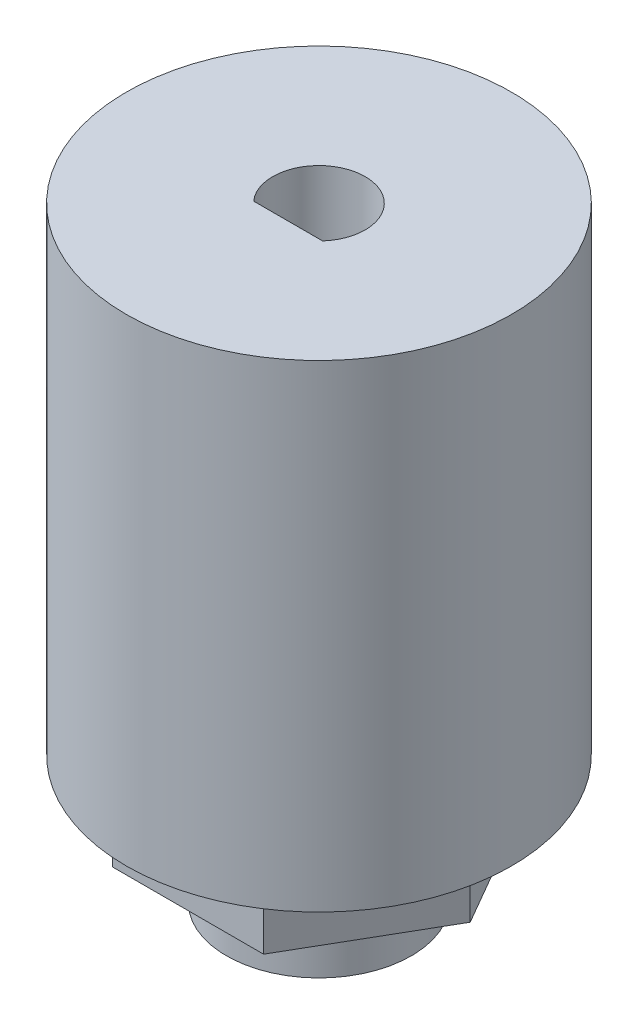
from build123d import *

# Parameters (mm, degrees)
SKETCH1_R           = 6
BOSS_EXTRUDE1_DEPTH = 3.8
BOSS_EXTRUDE2_DEPTH = 4.5
SKETCH3_R           = 12.5
BOSS_EXTRUDE3_DEPTH = 4
SKETCH4_R           = 12.5
BOSS_EXTRUDE4_DEPTH = 27
CUT_EXTRUDE1_DEPTH  = 44.092806824
SKETCH6_R           = 3.6
CUT_EXTRUDE2_DEPTH  = 6


with BuildPart() as part:
    # Sketch1 → Boss-Extrude1 (new body)
    with BuildSketch(Plane(origin=(0, 0, 0), x_dir=(1, 0, 0), z_dir=(0, 1, 0))):
        Circle(SKETCH1_R)
    extrude(amount=BOSS_EXTRUDE1_DEPTH)

    # Sketch2 → Boss-Extrude2 (add)
    with BuildSketch(Plane(origin=(0, 3.8, 0), x_dir=(1, 0, 0), z_dir=(0, 1, 0))):
        Polygon((9.814954576, 0), (4.907477288, 8.5), (-4.907477288, 8.5), (-9.814954576, 0), (-4.907477288, -8.5), (4.907477288, -8.5), align=None)
    extrude(amount=BOSS_EXTRUDE2_DEPTH)

    # Sketch3 → Boss-Extrude3 (add)
    with BuildSketch(Plane(origin=(0, 8.3, 0), x_dir=(1, 0, 0), z_dir=(0, 1, 0))):
        Circle(SKETCH3_R)
    extrude(amount=BOSS_EXTRUDE3_DEPTH)

    # Sketch4 → Boss-Extrude4 (add)
    with BuildSketch(Plane(origin=(0, 12.3, 0), x_dir=(1, 0, 0), z_dir=(0, 1, 0))):
        Circle(SKETCH4_R)
    extrude(amount=BOSS_EXTRUDE4_DEPTH)

    # Sketch5 → Cut-Extrude1 (cut, through all)
    with BuildSketch(Plane(origin=(0, 39.3, 0), x_dir=(1, 0, 0), z_dir=(0, 1, 0))):
        with BuildLine():
            ThreePointArc((3, 0), (-1.070466269, 2.802517077), (-2.236067977, -2))
            Line((-2.236067977, -2), (2.236067977, -2))
            ThreePointArc((2.236067977, -2), (2.802517077, -1.070466269), (3, 0))
        make_face()
    extrude(amount=-CUT_EXTRUDE1_DEPTH, mode=Mode.SUBTRACT)

    # Sketch6 → Cut-Extrude2 (cut)
    with BuildSketch(Plane.XZ):
        Circle(SKETCH6_R)
    extrude(amount=-CUT_EXTRUDE2_DEPTH, mode=Mode.SUBTRACT)


solid = part.part
